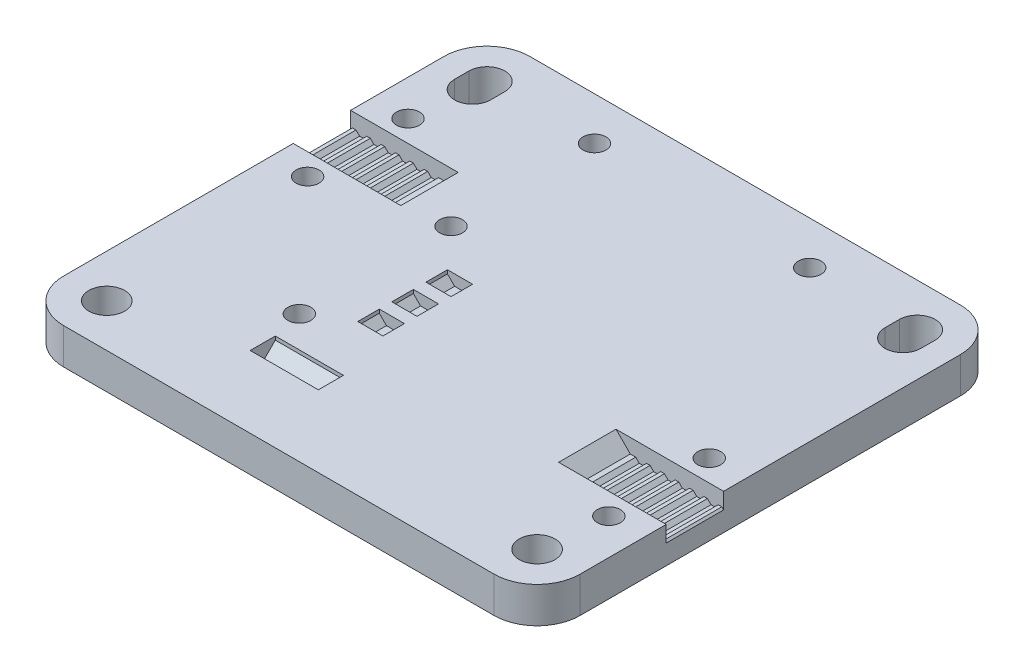
from build123d import *

# Parameters (mm, degrees)
SKETCH1_W           = 72
SKETCH1_H           = 65
SKETCH1_R           = 2.5
SKETCH1_R_2         = 1.6
BOSS_EXTRUDE1_DEPTH = 5
FILLET1_R           = 6
SKETCH2_W           = 15
SKETCH2_H           = 8
SKETCH2_W_2         = 9.5
SKETCH2_H_2         = 3.5
CUT_EXTRUDE1_DEPTH  = 2
CHAMFER1_SIZE       = 2
SKETCH3_W           = 0.5
SKETCH3_H           = 8
CUT_EXTRUDE2_DEPTH  = 0.5
CHAMFER2_SIZE       = 0.5
CHAMFER3_SIZE       = 0.25
CUT_EXTRUDE3_DEPTH  = 2.5
SKETCH5_W           = 3.5
SKETCH5_H           = 3
CUT_EXTRUDE4_DEPTH  = 1.5
CHAMFER4_SIZE       = 1.5
CHAMFER5_SIZE       = 1


with BuildPart() as part:
    # Sketch1 → Boss-Extrude1 (new body)
    with BuildSketch(Plane(origin=(0, 0, 0), x_dir=(1, 0, 0), z_dir=(0, 1, 0))):
        with Locations((36, 32.5)):
            Rectangle(SKETCH1_W, SKETCH1_H)
        with Locations(Location((6, 6, 0), (0, 0, 270))):
            Circle(SKETCH1_R, mode=Mode.SUBTRACT)
        with Locations(Location((66, 6, 0), (0, 0, 90))):
            Circle(SKETCH1_R, mode=Mode.SUBTRACT)
        with Locations(Location((5, 49, 0), (0, 0, 270))):
            Circle(SKETCH1_R_2, mode=Mode.SUBTRACT)
        with Locations(Location((5, 35, 0), (0, 0, 270))):
            Circle(SKETCH1_R_2, mode=Mode.SUBTRACT)
        with Locations(Location((21, 39, 0), (0, 0, 270))):
            Circle(SKETCH1_R_2, mode=Mode.SUBTRACT)
        with Locations(Location((21, 59, 0), (0, 0, 270))):
            Circle(SKETCH1_R_2, mode=Mode.SUBTRACT)
        with Locations(Location((51, 59, 0), (0, 0, 270))):
            Circle(SKETCH1_R_2, mode=Mode.SUBTRACT)
        with Locations(Location((21, 17.85, 0), (0, 0, 270))):
            Circle(SKETCH1_R_2, mode=Mode.SUBTRACT)
        with Locations(Location((67, 29, 0), (0, 0, 270))):
            Circle(SKETCH1_R_2, mode=Mode.SUBTRACT)
        with Locations(Location((67, 15, 0), (0, 0, 270))):
            Circle(SKETCH1_R_2, mode=Mode.SUBTRACT)
        with BuildLine():
            Line((8.5, 59), (8.5, 57))
            ThreePointArc((8.5, 57), (6, 54.5), (3.5, 57))
            Line((3.5, 57), (3.5, 59))
            ThreePointArc((3.5, 59), (6, 61.5), (8.5, 59))
        make_face(mode=Mode.SUBTRACT)
        with BuildLine():
            Line((68.5, 59), (68.5, 57))
            ThreePointArc((68.5, 57), (66, 54.5), (63.5, 57))
            Line((63.5, 57), (63.5, 59))
            ThreePointArc((63.5, 59), (66, 61.5), (68.5, 59))
        make_face(mode=Mode.SUBTRACT)
    extrude(amount=BOSS_EXTRUDE1_DEPTH)

    # Fillet1
    fillet1_edges = [part.edges().sort_by_distance(p)[0] for p in [
        (0, 2.5, -65),
        (72, 2.5, -65),
        (72, 2.5, 0),
        (0, 2.5, 0),
    ]]
    fillet(fillet1_edges, radius=FILLET1_R)

    # Sketch2 → Cut-Extrude1 (cut)
    with BuildSketch(Plane(origin=(0, 5, 0), x_dir=(1, 0, 0), z_dir=(0, 1, 0))):
        with Locations((7.5, 42)):
            Rectangle(SKETCH2_W, SKETCH2_H)
        with Locations((64.5, 22)):
            Rectangle(SKETCH2_W, SKETCH2_H)
        with Locations((26.75, 11.75)):
            Rectangle(SKETCH2_W_2, SKETCH2_H_2)
    extrude(amount=-CUT_EXTRUDE1_DEPTH, mode=Mode.SUBTRACT)

    # Chamfer1
    chamfer1_edges = [part.edges().sort_by_distance(p)[0] for p in [
        (57, 3, -22),
        (15, 3, -42),
    ]]
    chamfer(chamfer1_edges, length=CHAMFER1_SIZE - 0.0001)  # a hair under: the kernel refuses the full size

    # Sketch3 → Cut-Extrude2 (cut)
    with BuildSketch(Plane(origin=(0, 3, 0), x_dir=(1, 0, 0), z_dir=(0, 1, 0))):
        with Locations((1.5, 42)):
            Rectangle(SKETCH3_W, SKETCH3_H)
        with Locations((3.5, 42)):
            Rectangle(SKETCH3_W, SKETCH3_H)
        with Locations((5.5, 42)):
            Rectangle(SKETCH3_W, SKETCH3_H)
        with Locations((11.5, 42)):
            Rectangle(SKETCH3_W, SKETCH3_H)
        with Locations((7.5, 42)):
            Rectangle(SKETCH3_W, SKETCH3_H)
        with Locations((9.5, 42)):
            Rectangle(SKETCH3_W, SKETCH3_H)
        with Locations((70.5, 22)):
            Rectangle(SKETCH3_W, SKETCH3_H)
        with Locations((68.5, 22)):
            Rectangle(SKETCH3_W, SKETCH3_H)
        with Locations((66.5, 22)):
            Rectangle(SKETCH3_W, SKETCH3_H)
        with Locations((64.5, 22)):
            Rectangle(SKETCH3_W, SKETCH3_H)
        with Locations((62.5, 22)):
            Rectangle(SKETCH3_W, SKETCH3_H)
        with Locations((60.5, 22)):
            Rectangle(SKETCH3_W, SKETCH3_H)
    extrude(amount=-CUT_EXTRUDE2_DEPTH, mode=Mode.SUBTRACT)

    # Chamfer2
    chamfer2_edges = [part.edges().sort_by_distance(p)[0] for p in [
        (70.75, 3, -22),
        (70.25, 3, -22),
        (68.75, 3, -22),
        (68.25, 3, -22),
        (66.75, 3, -22),
        (66.25, 3, -22),
        (64.75, 3, -22),
        (64.25, 3, -22),
        (62.75, 3, -22),
        (62.25, 3, -22),
        (60.75, 3, -22),
        (60.25, 3, -22),
        (11.75, 3, -42),
        (11.25, 3, -42),
        (9.75, 3, -42),
        (9.25, 3, -42),
        (7.75, 3, -42),
        (7.25, 3, -42),
        (5.75, 3, -42),
        (5.25, 3, -42),
        (3.75, 3, -42),
        (3.25, 3, -42),
        (1.75, 3, -42),
        (1.25, 3, -42),
    ]]
    chamfer(chamfer2_edges, length=CHAMFER2_SIZE - 0.0001)  # a hair under: the kernel refuses the full size

    # Chamfer3
    chamfer3_edges = [part.edges().sort_by_distance(p)[0] for p in [
        (0, 3, -42),
        (72, 3, -22),
    ]]
    chamfer(chamfer3_edges, length=CHAMFER3_SIZE)

    # Sketch4 → Cut-Extrude3 (cut)
    with BuildSketch(Plane.XZ):
        Polygon((8.406366588, -49), (6.703183294, -46.05), (3.296816706, -46.05), (1.593633412, -49), (3.296816706, -51.95), (6.703183294, -51.95), align=None)
        Polygon((8.406366588, -35), (6.703183294, -32.05), (3.296816706, -32.05), (1.593633412, -35), (3.296816706, -37.95), (6.703183294, -37.95), align=None)
        Polygon((24.406366588, -39), (22.703183294, -36.05), (19.296816706, -36.05), (17.593633412, -39), (19.296816706, -41.95), (22.703183294, -41.95), align=None)
        Polygon((24.406366588, -17.85), (22.703183294, -14.9), (19.296816706, -14.9), (17.593633412, -17.85), (19.296816706, -20.8), (22.703183294, -20.8), align=None)
        Polygon((54.406366588, -59), (52.703183294, -56.05), (49.296816706, -56.05), (47.593633412, -59), (49.296816706, -61.95), (52.703183294, -61.95), align=None)
        Polygon((24.406366588, -59), (22.703183294, -56.05), (19.296816706, -56.05), (17.593633412, -59), (19.296816706, -61.95), (22.703183294, -61.95), align=None)
        Polygon((70.406366588, -15), (68.703183294, -12.05), (65.296816706, -12.05), (63.593633412, -15), (65.296816706, -17.95), (68.703183294, -17.95), align=None)
        Polygon((70.406366588, -29), (68.703183294, -26.05), (65.296816706, -26.05), (63.593633412, -29), (65.296816706, -31.95), (68.703183294, -31.95), align=None)
    extrude(amount=-CUT_EXTRUDE3_DEPTH, mode=Mode.SUBTRACT)

    # Sketch5 → Cut-Extrude4 (cut)
    with BuildSketch(Plane(origin=(0, 5, 0), x_dir=(1, 0, 0), z_dir=(0, 1, 0))):
        with Locations((27.75, 32)):
            Rectangle(SKETCH5_W, SKETCH5_H)
        with Locations((27.75, 27.25)):
            Rectangle(SKETCH5_W, SKETCH5_H)
        with Locations((27.75, 22.5)):
            Rectangle(SKETCH5_W, SKETCH5_H)
    extrude(amount=-CUT_EXTRUDE4_DEPTH, mode=Mode.SUBTRACT)

    # Chamfer4
    chamfer4_edges = [part.edges().sort_by_distance(p)[0] for p in [
        (26.75, 3, -10),
        (26.75, 3, -13.5),
    ]]
    chamfer(chamfer4_edges, length=CHAMFER4_SIZE)

    # Chamfer5
    chamfer5_edges = [part.edges().sort_by_distance(p)[0] for p in [
        (26, 3.5, -32),
        (29.5, 3.5, -32),
        (26, 3.5, -27.25),
        (29.5, 3.5, -27.25),
        (26, 3.5, -22.5),
        (29.5, 3.5, -22.5),
    ]]
    chamfer(chamfer5_edges, length=CHAMFER5_SIZE)


solid = part.part
